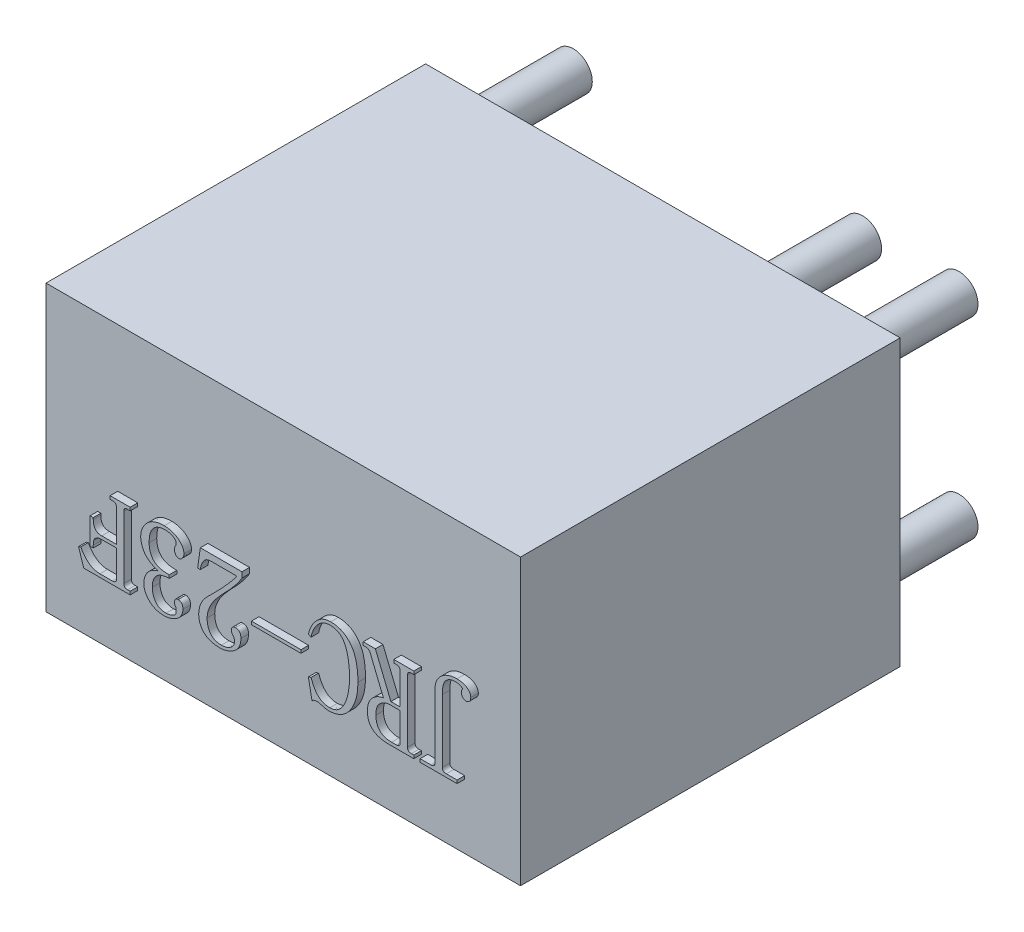
from build123d import *

# Parameters (mm, degrees)
SKETCH_1_W       = 12.5
SKETCH_1_H       = 7.5
EXTRUDE_1_DEPTH  = 10
SKETCH_2_R       = 0.5
EXTRUDE_2_DEPTH  = 3
WRAP_1_OUTLINE_W = 1.305555556
WRAP_1_OUTLINE_H = 0.083333333
WRAP_1_DEPTH     = 0.2


# Read off the part's stored shape, not the designer's step: 包覆1
with BuildPart() as part:
    # 草图1 → 凸台-拉伸1 (new body)
    with BuildSketch(Plane.XY):
        Rectangle(SKETCH_1_W, SKETCH_1_H)
    extrude(amount=EXTRUDE_1_DEPTH)

    # 草图2 → 凸台-拉伸2 (add)
    with BuildSketch(Plane(origin=(0, 0, 0), x_dir=(-1, 0, 0), z_dir=(0, 0, -1))):
        with Locations((-4.8, -2.54)):
            Circle(SKETCH_2_R)
        with Locations((-2.26, -2.54)):
            Circle(SKETCH_2_R)
        with Locations((5.36, -2.54)):
            Circle(SKETCH_2_R)
        with Locations(Location((-4.8, 2.54, 0), (0, 0, 180))):
            Circle(SKETCH_2_R)
        with Locations(Location((5.36, 2.54, 0), (0, 0, 180))):
            Circle(SKETCH_2_R)
        with Locations(Location((-2.26, 2.54, 0), (0, 0, 180))):
            Circle(SKETCH_2_R)
    extrude(amount=EXTRUDE_2_DEPTH)

    # 包覆1 outline → 包覆1 (add)
    # profile 1 of 7: a face of its own
    with BuildSketch(Plane.XY.offset(10)):
        with BuildLine():
            add(Edge.make_bspline(
                [(4.088541667, -1.972222222), (4.096110113, -1.972112893), (4.110551061, -1.971904287), (4.130804191, -1.966451246), (4.149495991, -1.960121566), (4.165109289, -1.949217072), (4.178890159, -1.936299355), (4.187652429, -1.919258866), (4.193825352, -1.899876347), (4.194229342, -1.885909039), (4.194444444, -1.878472222)],
                knots=[0, 0, 0, 0, 0.140958548, 0.268955466, 0.390585886, 0.507675788, 0.622491883, 0.739987644, 0.861557835, 1, 1, 1, 1], degree=3))
            Line((4.088541667, -1.972222222), (3.805555556, -1.972222222))
            Line((3.805555556, -1.972222222), (3.805555556, -2.055555556))
            Line((3.805555556, -2.055555556), (4.777777778, -2.055555556))
            Line((4.777777778, -2.055555556), (4.777777778, -1.972222222))
            Line((4.777777778, -1.972222222), (4.494791667, -1.972222222))
            add(Edge.make_bspline(
                [(4.388888889, -1.878472222), (4.388973594, -1.8859022), (4.38913189, -1.89978724), (4.394598992, -1.918896019), (4.400854026, -1.93587803), (4.412086053, -1.949552643), (4.426748668, -1.960335929), (4.446072554, -1.966900604), (4.468925899, -1.971904977), (4.485785593, -1.972111762), (4.494791667, -1.972222222)],
                knots=[0, 0, 0, 0, 0.135485952, 0.253194263, 0.362539149, 0.464425778, 0.5726392, 0.691831912, 0.835383441, 1, 1, 1, 1], degree=3))
            Line((4.388888889, -1.878472222), (4.388888889, -0.217881944))
            add(Edge.make_bspline(
                [(4.733940972, 0.25), (4.721343538, 0.24960677), (4.696797318, 0.248840557), (4.660710114, 0.244587293), (4.626541788, 0.236794903), (4.594157399, 0.22580886), (4.56349552, 0.212128236), (4.535292734, 0.194215889), (4.508061934, 0.17450857), (4.483146817, 0.150840614), (4.460443371, 0.122938134), (4.440944109, 0.089767258), (4.425172693, 0.05102853), (4.411685293, 0.007490039), (4.401423747, -0.041341391), (4.394345921, -0.095467493), (4.389304291, -0.154853823), (4.389031041, -0.196313482), (4.388888889, -0.217881944)],
                knots=[0, 0, 0, 0, 0.056791046, 0.110657896, 0.163492619, 0.214426009, 0.264615131, 0.314383114, 0.364724504, 0.415924345, 0.468779184, 0.52637318, 0.588622234, 0.656891803, 0.731582926, 0.813197416, 0.902820122, 1, 1, 1, 1], degree=3))
            add(Edge.make_bspline(
                [(4.924045139, 0.176649306), (4.919946215, 0.182646477), (4.911667194, 0.194759588), (4.894572882, 0.209279608), (4.875183778, 0.222233736), (4.852588681, 0.232514487), (4.82696126, 0.240072383), (4.798754461, 0.246505841), (4.767259116, 0.249031021), (4.745370749, 0.249667592), (4.733940972, 0.25)],
                knots=[0, 0, 0, 0, 0.10212947, 0.206281503, 0.313920344, 0.430902062, 0.554946282, 0.690759279, 0.838519129, 1, 1, 1, 1], degree=3))
            add(Edge.make_bspline(
                [(4.888888889, 0.091145833), (4.889086, 0.098827062), (4.889454279, 0.113178504), (4.893794243, 0.134823667), (4.905537796, 0.156316825), (4.917323057, 0.169264312), (4.924045139, 0.176649306)],
                knots=[0, 0, 0, 0, 0.241348464, 0.450930237, 0.686821346, 1, 1, 1, 1], degree=3))
            add(Edge.make_bspline(
                [(5.013888889, -0.055555556), (5.004842649, -0.0551368), (4.987208252, -0.054320493), (4.962511774, -0.045572326), (4.940349355, -0.032252077), (4.921933329, -0.013406735), (4.907143353, 0.009226274), (4.896950146, 0.034666745), (4.889959347, 0.062130269), (4.889253543, 0.081261612), (4.888888889, 0.091145833)],
                knots=[0, 0, 0, 0, 0.125442031, 0.244531959, 0.360236386, 0.482701014, 0.607819324, 0.734227546, 0.862688476, 1, 1, 1, 1], degree=3))
            add(Edge.make_bspline(
                [(5.138888889, 0.090277778), (5.13842087, 0.078803022), (5.137538794, 0.057176519), (5.130159463, 0.026851436), (5.117590986, 0.000989043), (5.099743342, -0.019371703), (5.07995275, -0.035445333), (5.058721931, -0.046901386), (5.036671126, -0.054426923), (5.021470497, -0.055179963), (5.013888889, -0.055555556)],
                knots=[0, 0, 0, 0, 0.160300387, 0.302118561, 0.433320879, 0.55819257, 0.677635349, 0.788085582, 0.894303581, 1, 1, 1, 1], degree=3))
            add(Edge.make_bspline(
                [(4.773003472, 0.333333333), (4.787326607, 0.332996096), (4.815136678, 0.332341311), (4.855686225, 0.329790221), (4.893398279, 0.323248709), (4.928847993, 0.315939136), (4.961407857, 0.305040651), (4.992116512, 0.293524587), (5.019375669, 0.277891174), (5.05172764, 0.255975961), (5.085643853, 0.225015335), (5.116617626, 0.183643765), (5.135293732, 0.137888131), (5.137685895, 0.106208926), (5.138888889, 0.090277778)],
                knots=[0, 0, 0, 0, 0.088162938, 0.171178832, 0.249616068, 0.323475084, 0.393569338, 0.460678001, 0.524828866, 0.586305594, 0.700969595, 0.805482684, 0.902179229, 1, 1, 1, 1], degree=3))
            add(Edge.make_bspline(
                [(4.194444444, -0.216579861), (4.194930165, -0.195723339), (4.195881562, -0.15487097), (4.203726056, -0.095384785), (4.216885414, -0.039495085), (4.234399195, 0.013162756), (4.25836255, 0.061901176), (4.286282522, 0.107974029), (4.320655977, 0.149658052), (4.359272257, 0.187816161), (4.401619371, 0.221959081), (4.447077908, 0.251581746), (4.495122743, 0.276986659), (4.545742315, 0.297636127), (4.598862137, 0.314031692), (4.654590738, 0.324976427), (4.712913691, 0.332279773), (4.752725666, 0.3329778), (4.773003472, 0.333333333)],
                knots=[0, 0, 0, 0, 0.069612051, 0.13635146, 0.199850536, 0.26109993, 0.321155047, 0.380800892, 0.440544437, 0.500996409, 0.561794703, 0.621810962, 0.681873847, 0.742955424, 0.804069456, 0.867155717, 0.932337178, 1, 1, 1, 1], degree=3))
            Line((4.194444444, -0.216579861), (4.194444444, -1.878472222))
        make_face()
    # profile 2 of 7: a face of its own
    with BuildSketch(Plane.XY.offset(10)):
        with BuildLine():
            add(Edge.make_bspline(
                [(2.490885417, -0.219184028), (2.487165761, -0.211982946), (2.480161265, -0.198422563), (2.467370087, -0.180822312), (2.453919873, -0.16657186), (2.434877746, -0.152904432), (2.408602473, -0.141275743), (2.386272878, -0.139689625), (2.375, -0.138888889)],
                knots=[0, 0, 0, 0, 0.162391778, 0.305800563, 0.435122477, 0.553562638, 0.774620449, 1, 1, 1, 1], degree=3))
            Line((2.490885417, -0.219184028), (2.838107639, -1.069444444))
            add(Edge.make_bspline(
                [(2.416666667, -1.5859375), (2.417096819, -1.566968632), (2.417936427, -1.529943569), (2.424064431, -1.476079891), (2.434035197, -1.425406088), (2.447707637, -1.377876596), (2.46605519, -1.333834687), (2.488377777, -1.293135992), (2.514396678, -1.255583568), (2.5446159, -1.221721065), (2.577410076, -1.191408487), (2.611259092, -1.163868754), (2.646282938, -1.139860757), (2.682279227, -1.11882214), (2.719762172, -1.101619149), (2.758094361, -1.087060724), (2.7976195, -1.076095104), (2.824603527, -1.071662656), (2.838107639, -1.069444444)],
                knots=[0, 0, 0, 0, 0.077701382, 0.151664214, 0.221756879, 0.289088697, 0.353921931, 0.416788188, 0.478940702, 0.540664994, 0.602309553, 0.661737288, 0.719278899, 0.776107893, 0.832324685, 0.888029848, 0.943964724, 1, 1, 1, 1], degree=3))
            add(Edge.make_bspline(
                [(2.975260417, -2.055555556), (2.953543566, -2.0552894), (2.91133358, -2.054772087), (2.850034847, -2.048852125), (2.792488305, -2.040143891), (2.738965897, -2.02673139), (2.688659579, -2.011218709), (2.642592513, -1.990537474), (2.600214093, -1.966683523), (2.561638435, -1.939210723), (2.527275008, -1.907993741), (2.497341697, -1.872953902), (2.472468763, -1.833842549), (2.452240544, -1.791189538), (2.435835525, -1.74516498), (2.42489774, -1.695291804), (2.417692442, -1.641848791), (2.417014841, -1.604915229), (2.416666667, -1.5859375)],
                knots=[0, 0, 0, 0, 0.078231985, 0.152055705, 0.221740855, 0.287748152, 0.350731523, 0.411184701, 0.469320569, 0.52574573, 0.58147288, 0.636213327, 0.691315067, 0.747980581, 0.806022863, 0.866984239, 0.931651949, 1, 1, 1, 1], degree=3))
            Line((2.975260417, -2.055555556), (3.638888889, -2.055555556))
            Line((3.638888889, -2.055555556), (3.638888889, -1.972222222))
            Line((3.638888889, -1.972222222), (3.572048611, -1.972222222))
            add(Edge.make_bspline(
                [(3.472222222, -1.879774306), (3.472387366, -1.887036916), (3.472698061, -1.900700534), (3.47721817, -1.919772096), (3.484033833, -1.936083896), (3.493799972, -1.949879127), (3.507739535, -1.96027242), (3.525595337, -1.967555045), (3.547555831, -1.971704983), (3.563494051, -1.972041567), (3.572048611, -1.972222222)],
                knots=[0, 0, 0, 0, 0.137957594, 0.25954853, 0.370573832, 0.47303595, 0.577150492, 0.696855208, 0.837292342, 1, 1, 1, 1], degree=3))
            Line((3.472222222, -1.879774306), (3.472222222, -0.231336806))
            add(Edge.make_bspline(
                [(3.572048611, -0.138888889), (3.563494207, -0.139069608), (3.547556278, -0.139406311), (3.525593923, -0.143555487), (3.507743752, -0.150840417), (3.493786515, -0.161226474), (3.484162217, -0.174938457), (3.477036378, -0.191128588), (3.47276955, -0.210288732), (3.472410902, -0.224080904), (3.472222222, -0.231336806)],
                knots=[0, 0, 0, 0, 0.162681349, 0.303095774, 0.422781134, 0.526878841, 0.629324391, 0.737809695, 0.862064713, 1, 1, 1, 1], degree=3))
            Line((3.572048611, -0.138888889), (3.638888889, -0.138888889))
            Line((3.638888889, -0.138888889), (3.638888889, -0.055555556))
            Line((3.638888889, -0.055555556), (3.111111111, -0.055555556))
            Line((3.111111111, -0.055555556), (3.111111111, -0.138888889))
            Line((3.111111111, -0.138888889), (3.177951389, -0.138888889))
            add(Edge.make_bspline(
                [(3.277777778, -0.23046875), (3.277477119, -0.223346381), (3.276903442, -0.209756462), (3.271707861, -0.190722897), (3.262775046, -0.174491773), (3.250438176, -0.161350435), (3.235295725, -0.151348236), (3.218160413, -0.143837223), (3.198711517, -0.139457509), (3.185063123, -0.139083679), (3.177951389, -0.138888889)],
                knots=[0, 0, 0, 0, 0.138944546, 0.265114757, 0.381504874, 0.497482502, 0.613494561, 0.733732761, 0.861256802, 1, 1, 1, 1], degree=3))
            Line((3.277777778, -0.23046875), (3.277777778, -1.055555556))
            Line((3.277777778, -1.055555556), (3.03515625, -1.055555556))
            Line((3.03515625, -1.055555556), (2.626302083, -0.055555556))
            Line((2.626302083, -0.055555556), (2.305555556, -0.055555556))
            Line((2.305555556, -0.055555556), (2.305555556, -0.138888889))
            Line((2.305555556, -0.138888889), (2.375, -0.138888889))
        make_face()
        with BuildLine():
            add(Edge.make_bspline(
                [(3.03125, -1.138888889), (3.017490666, -1.13923764), (2.99046715, -1.139922592), (2.950845723, -1.144860376), (2.912988051, -1.152432415), (2.876932652, -1.163885318), (2.84284177, -1.17881705), (2.809929824, -1.195918183), (2.779363984, -1.217268616), (2.750378131, -1.241153366), (2.724136648, -1.26881048), (2.700779866, -1.299704158), (2.681799441, -1.33482083), (2.666278182, -1.373333001), (2.653486266, -1.415084676), (2.645079701, -1.460659421), (2.639796798, -1.509712044), (2.639197846, -1.543677507), (2.638888889, -1.561197917)],
                knots=[0, 0, 0, 0, 0.063066198, 0.123862862, 0.182789201, 0.239845589, 0.29689041, 0.353268108, 0.409563813, 0.467481117, 0.525185349, 0.583950958, 0.644508365, 0.707571074, 0.77408654, 0.844330246, 0.919700848, 1, 1, 1, 1], degree=3))
            Line((3.03125, -1.138888889), (3.277777778, -1.138888889))
            Line((3.277777778, -1.138888889), (3.277777778, -1.881076389))
            add(Edge.make_bspline(
                [(3.177083333, -1.972222222), (3.184203126, -1.972047215), (3.197866984, -1.971711352), (3.217285067, -1.967051219), (3.234861313, -1.960412604), (3.250017173, -1.950166651), (3.262273786, -1.936943428), (3.2718113, -1.920959453), (3.276868214, -1.901769279), (3.277465004, -1.888192088), (3.277777778, -1.881076389)],
                knots=[0, 0, 0, 0, 0.138339697, 0.265492866, 0.386895269, 0.502569935, 0.61821027, 0.735656265, 0.86145954, 1, 1, 1, 1], degree=3))
            Line((3.177083333, -1.972222222), (3.053819444, -1.972222222))
            add(Edge.make_bspline(
                [(2.638888889, -1.561197917), (2.63922911, -1.576980877), (2.639889335, -1.607608856), (2.644807308, -1.652292368), (2.652460975, -1.694262324), (2.663217458, -1.733742317), (2.677693832, -1.770296677), (2.694908752, -1.804321795), (2.715706694, -1.835421613), (2.739042949, -1.864246017), (2.765976626, -1.890258809), (2.797291268, -1.911671922), (2.831377227, -1.930829654), (2.869352049, -1.945556648), (2.910438672, -1.958177225), (2.955222001, -1.965814064), (3.003332318, -1.971386696), (3.036584396, -1.971936994), (3.053819444, -1.972222222)],
                knots=[0, 0, 0, 0, 0.070832955, 0.137456492, 0.201524319, 0.262183892, 0.320792604, 0.377718557, 0.433013528, 0.488392332, 0.543972575, 0.600366342, 0.658207284, 0.719106242, 0.78280107, 0.850818457, 0.922676981, 1, 1, 1, 1], degree=3))
        make_face(mode=Mode.SUBTRACT)
    # profile 3 of 7: a face of its own
    with BuildSketch(Plane.XY.offset(10)):
        with BuildLine():
            add(Edge.make_bspline(
                [(2.166666667, -1.049479167), (2.166197382, -1.085964313), (2.165279285, -1.157342956), (2.154740166, -1.261983369), (2.139027282, -1.361957037), (2.116595557, -1.457404636), (2.086958839, -1.547733923), (2.051271798, -1.633451748), (2.009076087, -1.714363029), (1.960982653, -1.790076935), (1.906814648, -1.85850693), (1.848294513, -1.919117761), (1.784355397, -1.969743), (1.716011053, -2.011669105), (1.642622871, -2.043745336), (1.564691194, -2.066996749), (1.482093617, -2.080483106), (1.42554064, -2.082370735), (1.396701389, -2.083333333)],
                knots=[0, 0, 0, 0, 0.075844892, 0.148381082, 0.218467558, 0.286186838, 0.352024085, 0.415944427, 0.479056046, 0.541565299, 0.602177839, 0.660258585, 0.716359914, 0.771311197, 0.826540971, 0.882416776, 0.94003831, 1, 1, 1, 1], degree=3))
            add(Edge.make_bspline(
                [(1.44921875, -0.027777778), (1.476031071, -0.028480427), (1.528476181, -0.029854813), (1.604843027, -0.04200029), (1.677136664, -0.060952467), (1.745250939, -0.087968388), (1.809092449, -0.122958993), (1.868574068, -0.165820353), (1.923343471, -0.216771461), (1.974576495, -0.274618975), (2.020488394, -0.341170307), (2.05983079, -0.416607154), (2.092710911, -0.500845177), (2.119996679, -0.593626646), (2.140919533, -0.69527567), (2.155928489, -0.805619825), (2.165068241, -0.92461382), (2.166121954, -1.006927505), (2.166666667, -1.049479167)],
                knots=[0, 0, 0, 0, 0.056891628, 0.111280468, 0.163732767, 0.215295249, 0.266431466, 0.317920706, 0.37052657, 0.424936222, 0.481680896, 0.541722438, 0.605149109, 0.673375766, 0.746809909, 0.825261242, 0.909669645, 1, 1, 1, 1], degree=3))
            add(Edge.make_bspline(
                [(0.861111111, -0.602864583), (0.866163456, -0.582235139), (0.876115317, -0.54160027), (0.896039642, -0.482885565), (0.918408181, -0.426836308), (0.944190166, -0.373671603), (0.972745877, -0.323260179), (1.00460376, -0.275630359), (1.039743175, -0.230958731), (1.077788035, -0.189500546), (1.117979714, -0.151554994), (1.160456515, -0.118614826), (1.204637418, -0.090564007), (1.250230686, -0.067464522), (1.29760702, -0.049361167), (1.346698806, -0.036912944), (1.397478293, -0.02933131), (1.431831519, -0.028299838), (1.44921875, -0.027777778)],
                knots=[0, 0, 0, 0, 0.071661977, 0.141156253, 0.209079882, 0.275260678, 0.340437452, 0.404503355, 0.468494763, 0.532093639, 0.594285731, 0.65484975, 0.713242506, 0.770681973, 0.827097131, 0.884069671, 0.941324074, 1, 1, 1, 1], degree=3))
            Line((0.861111111, -0.602864583), (0.931857639, -0.638888889))
            add(Edge.make_bspline(
                [(1.437934028, -0.111111111), (1.422423737, -0.111465481), (1.391963449, -0.112161421), (1.347197475, -0.119543045), (1.304123872, -0.130714519), (1.262458101, -0.146482363), (1.222590734, -0.166880725), (1.184394285, -0.191996703), (1.147992403, -0.221600361), (1.113317322, -0.255485555), (1.081050649, -0.29303418), (1.051342008, -0.333697889), (1.024428761, -0.377261988), (1.000013717, -0.423736369), (0.978828508, -0.473468499), (0.960312199, -0.525987042), (0.94392286, -0.581245162), (0.935929164, -0.619436458), (0.931857639, -0.638888889)],
                knots=[0, 0, 0, 0, 0.058468665, 0.11482521, 0.170695924, 0.226149128, 0.282540026, 0.339312686, 0.398303879, 0.459291632, 0.521989676, 0.584875145, 0.649099026, 0.715019296, 0.782749722, 0.852842953, 0.925046738, 1, 1, 1, 1], degree=3))
            add(Edge.make_bspline(
                [(1.944444444, -1.049479167), (1.944173748, -1.01387987), (1.943646295, -0.944514564), (1.937758602, -0.843465899), (1.929007459, -0.748271471), (1.915903467, -0.659213413), (1.899655622, -0.575955345), (1.879268078, -0.498711858), (1.855520607, -0.42709473), (1.827949253, -0.361641881), (1.796690211, -0.302376198), (1.759668337, -0.25127587), (1.717874495, -0.208006529), (1.67142136, -0.17220132), (1.619680114, -0.144800936), (1.563233618, -0.125066851), (1.502085118, -0.11321406), (1.45968882, -0.111824259), (1.437934028, -0.111111111)],
                knots=[0, 0, 0, 0, 0.08937913, 0.174155429, 0.254079071, 0.329345058, 0.400091793, 0.466972155, 0.529811502, 0.589390821, 0.64514481, 0.697681434, 0.747265071, 0.79572882, 0.844323105, 0.893613092, 0.945409736, 1, 1, 1, 1], degree=3))
            add(Edge.make_bspline(
                [(1.426215278, -2), (1.446243807, -1.999150308), (1.485694298, -1.997476656), (1.543084688, -1.984693682), (1.596925697, -1.962988155), (1.64730223, -1.932822128), (1.69355509, -1.893436032), (1.736435973, -1.84601983), (1.775364521, -1.789965066), (1.810616486, -1.726264318), (1.84174026, -1.656193249), (1.869743285, -1.581670972), (1.892394431, -1.502742149), (1.911740627, -1.420080068), (1.926133758, -1.333198162), (1.937251415, -1.242288647), (1.943089722, -1.147212807), (1.943987116, -1.082472146), (1.944444444, -1.049479167)],
                knots=[0, 0, 0, 0, 0.050261158, 0.099000147, 0.146758664, 0.19547599, 0.24575421, 0.298730247, 0.355570674, 0.416715881, 0.481262585, 0.547928245, 0.616438893, 0.687284604, 0.760978705, 0.837441015, 0.917157081, 1, 1, 1, 1], degree=3))
            add(Edge.make_bspline(
                [(0.931857639, -1.555555556), (0.937746544, -1.573129803), (0.949287517, -1.607571508), (0.969362875, -1.656880566), (0.990549347, -1.703216216), (1.013649277, -1.746148136), (1.037799507, -1.78612168), (1.063523655, -1.822882538), (1.090802511, -1.856247006), (1.119508734, -1.88647599), (1.150233128, -1.913326442), (1.183050203, -1.936647921), (1.218122231, -1.956618747), (1.255667677, -1.971858933), (1.295027698, -1.98477964), (1.336749141, -1.993821364), (1.380797555, -1.999032422), (1.410865486, -1.999672989), (1.426215278, -2)],
                knots=[0, 0, 0, 0, 0.077291875, 0.151475268, 0.22194541, 0.28971007, 0.354704288, 0.416648996, 0.47668606, 0.534305854, 0.590336361, 0.646597119, 0.701987031, 0.75824779, 0.81530871, 0.874610369, 0.93598812, 1, 1, 1, 1], degree=3))
            Line((0.931857639, -1.555555556), (0.861111111, -1.578559028))
            Line((0.861111111, -1.578559028), (0.958333333, -2.083333333))
            add(Edge.make_bspline(
                [(1.088541667, -2.024739583), (1.074177712, -2.025255583), (1.048159693, -2.026190235), (1.011671124, -2.034486697), (0.980438292, -2.053395644), (0.966078743, -2.072843394), (0.958333333, -2.083333333)],
                knots=[0, 0, 0, 0, 0.287283444, 0.520368262, 0.741291015, 1, 1, 1, 1], degree=3))
            add(Edge.make_bspline(
                [(1.396701389, -2.083333333), (1.38293739, -2.083027836), (1.355149985, -2.082411084), (1.313643328, -2.076448047), (1.271992907, -2.067320888), (1.231300455, -2.054674732), (1.192447809, -2.040940375), (1.155221104, -2.032016423), (1.121014529, -2.025783199), (1.098982206, -2.025075122), (1.088541667, -2.024739583)],
                knots=[0, 0, 0, 0, 0.130963566, 0.264395382, 0.398401772, 0.536528105, 0.669810553, 0.79040482, 0.900678349, 1, 1, 1, 1], degree=3))
        make_face()
    # profile 4 of 7: a face of its own
    with BuildSketch(Plane.XY.offset(10)):
        with BuildLine():
            add(Edge.make_bspline(
                [(-1.427083333, -2), (-1.40414308, -1.99913185), (-1.359695541, -1.997449778), (-1.295724497, -1.983007049), (-1.236744481, -1.960248428), (-1.192900024, -1.932654176), (-1.161291576, -1.907400133), (-1.141084332, -1.886443924), (-1.123292098, -1.864808729), (-1.109466491, -1.841350229), (-1.097996022, -1.817214971), (-1.089989621, -1.791521792), (-1.08585663, -1.76460227), (-1.085045308, -1.746250659), (-1.084635417, -1.736979167)],
                knots=[0, 0, 0, 0, 0.143267064, 0.277584921, 0.407933192, 0.536705751, 0.599714332, 0.660481917, 0.718402274, 0.774404942, 0.830253987, 0.88518717, 0.941994943, 1, 1, 1, 1], degree=3))
            add(Edge.make_bspline(
                [(-1.805555556, -1.566840278), (-1.805415038, -1.583928034), (-1.805142919, -1.617019332), (-1.799920823, -1.665103024), (-1.792989563, -1.710169048), (-1.782322489, -1.75202545), (-1.76963443, -1.791063336), (-1.752879167, -1.826639328), (-1.733840969, -1.859534123), (-1.711667926, -1.889212926), (-1.686320347, -1.915502171), (-1.657914829, -1.938082789), (-1.626713885, -1.957568668), (-1.5923186, -1.972974748), (-1.555093588, -1.985253773), (-1.515070529, -1.993752634), (-1.472078237, -1.999113254), (-1.442435915, -1.999697436), (-1.427083333, -2)],
                knots=[0, 0, 0, 0, 0.077930574, 0.150916467, 0.220490125, 0.285821419, 0.347828954, 0.407497221, 0.464905586, 0.521023883, 0.576119231, 0.631075956, 0.686222705, 0.743539885, 0.80262454, 0.864783026, 0.929967373, 1, 1, 1, 1], degree=3))
            add(Edge.make_bspline(
                [(-1.440538194, -0.864149306), (-1.470154157, -0.896504564), (-1.527098977, -0.958716432), (-1.602958671, -1.053894668), (-1.666339819, -1.146310097), (-1.717172184, -1.236076054), (-1.75619145, -1.322884395), (-1.784428615, -1.406497601), (-1.801965691, -1.487552765), (-1.804379447, -1.540864178), (-1.805555556, -1.566840278)],
                knots=[0, 0, 0, 0, 0.162474748, 0.312402308, 0.450516974, 0.577238445, 0.694086835, 0.802568253, 0.903800959, 1, 1, 1, 1], degree=3))
            add(Edge.make_bspline(
                [(-0.888888889, -0.200086806), (-0.899902826, -0.21935435), (-0.923788025, -0.261138601), (-0.968659437, -0.32491937), (-1.021368897, -0.39725182), (-1.07259622, -0.461290258), (-1.118154202, -0.516483803), (-1.155939432, -0.560870971), (-1.196761533, -0.606740482), (-1.240319508, -0.65448938), (-1.286183692, -0.704529732), (-1.3352742, -0.756007803), (-1.387022723, -0.809443525), (-1.422437761, -0.845646276), (-1.440538194, -0.864149306)],
                knots=[0, 0, 0, 0, 0.076888688, 0.166743419, 0.270053403, 0.387140391, 0.450899533, 0.518129809, 0.589177495, 0.663728026, 0.742159742, 0.824454616, 0.910279711, 1, 1, 1, 1], degree=3))
            Line((-0.888888889, -0.200086806), (-0.888888889, -0.055555556))
            Line((-0.888888889, -0.055555556), (-1.984809028, -0.055555556))
            Line((-1.984809028, -0.055555556), (-2.055555556, -0.555555556))
            Line((-2.055555556, -0.555555556), (-1.985677083, -0.555555556))
            add(Edge.make_bspline(
                [(-1.717013889, -0.222222222), (-1.733927873, -0.223161785), (-1.767078142, -0.225003266), (-1.814380333, -0.24148279), (-1.856982433, -0.268272246), (-1.894737006, -0.305615564), (-1.927065518, -0.353355655), (-1.952724194, -0.41169216), (-1.973130715, -0.479950523), (-1.981334906, -0.529389382), (-1.985677083, -0.555555556)],
                knots=[0, 0, 0, 0, 0.107580609, 0.210850743, 0.315284474, 0.426183702, 0.54695673, 0.680715486, 0.831014423, 1, 1, 1, 1], degree=3))
            Line((-1.717013889, -0.222222222), (-1.027777778, -0.222222222))
            add(Edge.make_bspline(
                [(-1.7578125, -1.039930556), (-1.730580476, -1.012909131), (-1.677568793, -0.960307413), (-1.600919646, -0.883163921), (-1.528983058, -0.81012677), (-1.462272004, -0.740696539), (-1.400163169, -0.675194687), (-1.343000801, -0.613716096), (-1.290617487, -0.556266722), (-1.243339749, -0.502549093), (-1.201070378, -0.452570547), (-1.162589458, -0.407383573), (-1.128661442, -0.366312458), (-1.099780114, -0.329105492), (-1.075278553, -0.296430629), (-1.055186542, -0.268154827), (-1.039287037, -0.24418305), (-1.031295724, -0.228934818), (-1.027777778, -0.222222222)],
                knots=[0, 0, 0, 0, 0.104788244, 0.203987822, 0.297043227, 0.384801622, 0.466985722, 0.543601701, 0.614098943, 0.679341921, 0.7390507, 0.792888057, 0.841463035, 0.884544884, 0.921533799, 0.953002124, 0.979310535, 1, 1, 1, 1], degree=3))
            add(Edge.make_bspline(
                [(-2.027777778, -1.591145833), (-2.027046901, -1.567656399), (-2.025571013, -1.520223289), (-2.012757221, -1.449371608), (-1.992700109, -1.378526059), (-1.964456633, -1.307896344), (-1.926769547, -1.238257008), (-1.879924532, -1.169671985), (-1.823363292, -1.102744469), (-1.780056638, -1.061245955), (-1.7578125, -1.039930556)],
                knots=[0, 0, 0, 0, 0.111388457, 0.224930963, 0.340544613, 0.460380004, 0.585085801, 0.715521829, 0.853879924, 1, 1, 1, 1], degree=3))
            add(Edge.make_bspline(
                [(-1.472222222, -2.083333333), (-1.495093848, -2.082925322), (-1.539488507, -2.082133358), (-1.603847863, -2.075796953), (-1.663416877, -2.064326438), (-1.718604153, -2.049589824), (-1.768706373, -2.029221826), (-1.81484159, -2.005662245), (-1.855889204, -1.976583839), (-1.892514267, -1.943669516), (-1.923808187, -1.906859688), (-1.9521373, -1.868624532), (-1.975533281, -1.82761609), (-1.994634747, -1.78454929), (-2.009656382, -1.739370484), (-2.01976723, -1.691900478), (-2.02662571, -1.642270173), (-2.027389273, -1.608386184), (-2.027777778, -1.591145833)],
                knots=[0, 0, 0, 0, 0.081543393, 0.1582787, 0.230210067, 0.297666768, 0.361557987, 0.422701798, 0.481949248, 0.540382696, 0.597789365, 0.653918738, 0.709839133, 0.765723829, 0.821675145, 0.879248439, 0.938560975, 1, 1, 1, 1], degree=3))
            add(Edge.make_bspline(
                [(-0.916666667, -1.588975694), (-0.917046704, -1.608546116), (-0.917785528, -1.646592699), (-0.926999745, -1.701832988), (-0.940640466, -1.753558235), (-0.959756133, -1.802032615), (-0.985140752, -1.846409124), (-1.016015229, -1.887276947), (-1.052081445, -1.924861238), (-1.093776312, -1.95771753), (-1.138148221, -1.986680659), (-1.183495825, -2.012715252), (-1.229894915, -2.034257698), (-1.276871773, -2.052172225), (-1.324589866, -2.066224489), (-1.373058987, -2.076244291), (-1.422466229, -2.081872625), (-1.455571154, -2.082844501), (-1.472222222, -2.083333333)],
                knots=[0, 0, 0, 0, 0.070597237, 0.137247101, 0.20162441, 0.263518204, 0.324818258, 0.385628824, 0.448069205, 0.512361668, 0.576840646, 0.639307249, 0.701008925, 0.761359959, 0.820707732, 0.880440557, 0.939864162, 1, 1, 1, 1], degree=3))
            add(Edge.make_bspline(
                [(-1.058159722, -1.416666667), (-1.047691092, -1.41713723), (-1.02776755, -1.418032791), (-0.999530015, -1.425639209), (-0.974661759, -1.438198146), (-0.953878255, -1.456778251), (-0.935959752, -1.48033907), (-0.925057933, -1.511304409), (-0.917325571, -1.54793395), (-0.91689748, -1.574598788), (-0.916666667, -1.588975694)],
                knots=[0, 0, 0, 0, 0.123149291, 0.234373542, 0.341865125, 0.448174475, 0.560335149, 0.686629183, 0.831039556, 1, 1, 1, 1], degree=3))
            add(Edge.make_bspline(
                [(-1.166666667, -1.53125), (-1.166384142, -1.522248588), (-1.165850069, -1.505232652), (-1.160598131, -1.481617881), (-1.152433513, -1.461361581), (-1.14040323, -1.444777103), (-1.12462828, -1.431716965), (-1.10533695, -1.422786606), (-1.082747507, -1.417455429), (-1.066728308, -1.416941542), (-1.058159722, -1.416666667)],
                knots=[0, 0, 0, 0, 0.149040261, 0.281740182, 0.398917937, 0.508796429, 0.617833734, 0.734790282, 0.858140715, 1, 1, 1, 1], degree=3))
            add(Edge.make_bspline(
                [(-1.084635417, -1.736979167), (-1.085079601, -1.725924285), (-1.08593926, -1.704529017), (-1.094170332, -1.674187342), (-1.106618207, -1.64621979), (-1.125567312, -1.623127809), (-1.143912215, -1.601150517), (-1.156404725, -1.577783689), (-1.165165986, -1.5547223), (-1.166171664, -1.538992391), (-1.166666667, -1.53125)],
                knots=[0, 0, 0, 0, 0.146108122, 0.282773037, 0.413952653, 0.548108497, 0.676529107, 0.792315623, 0.897776042, 1, 1, 1, 1], degree=3))
        make_face()
    # profile 5 of 7: a face of its own
    with BuildSketch(Plane.XY.offset(10)):
        with BuildLine():
            add(Edge.make_bspline(
                [(-2.933159722, -0.027777778), (-2.915781011, -0.028055692), (-2.881650929, -0.028601489), (-2.831470677, -0.034556526), (-2.783137513, -0.04355799), (-2.736568955, -0.056232708), (-2.691683776, -0.072091709), (-2.649020976, -0.092382859), (-2.607905093, -0.115767981), (-2.569443474, -0.143047738), (-2.533739943, -0.17188409), (-2.502607012, -0.202649817), (-2.475910024, -0.234084636), (-2.454486587, -0.267167193), (-2.437077689, -0.301016934), (-2.425700055, -0.336555212), (-2.417655578, -0.372758444), (-2.416996852, -0.397380484), (-2.416666667, -0.409722222)],
                knots=[0, 0, 0, 0, 0.073670561, 0.144681743, 0.213997339, 0.282019047, 0.349171789, 0.415597375, 0.482113583, 0.54952093, 0.615357295, 0.676534078, 0.734904909, 0.789874331, 0.843382637, 0.895771064, 0.947755498, 1, 1, 1, 1], degree=3))
            add(Edge.make_bspline(
                [(-3.555555556, -0.591145833), (-3.555089678, -0.572739257), (-3.554171925, -0.53647927), (-3.545833458, -0.483054648), (-3.533546749, -0.430995761), (-3.515079641, -0.380811954), (-3.492035177, -0.332148457), (-3.463386039, -0.285640843), (-3.430435006, -0.240129048), (-3.391957071, -0.197207965), (-3.349294295, -0.157059908), (-3.301773493, -0.122261985), (-3.250024891, -0.092943513), (-3.19433402, -0.069217621), (-3.134753769, -0.050398475), (-3.071245352, -0.037031432), (-3.003525714, -0.029185692), (-2.957052429, -0.028255834), (-2.933159722, -0.027777778)],
                knots=[0, 0, 0, 0, 0.058709639, 0.115654902, 0.172213174, 0.229180899, 0.285979942, 0.343791074, 0.403271069, 0.465087321, 0.527494046, 0.589928099, 0.652587152, 0.716918571, 0.782782919, 0.851703655, 0.923758322, 1, 1, 1, 1], degree=3))
            add(Edge.make_bspline(
                [(-3.103298611, -1.142795139), (-3.124365476, -1.134919111), (-3.165207505, -1.119649969), (-3.223090446, -1.093766295), (-3.275408505, -1.06529483), (-3.322862933, -1.035531969), (-3.365201436, -1.00382573), (-3.402305268, -0.970320781), (-3.434507943, -0.935071775), (-3.468869959, -0.885710433), (-3.503073475, -0.822591198), (-3.532995643, -0.745601171), (-3.551861775, -0.668437549), (-3.554333882, -0.616709132), (-3.555555556, -0.591145833)],
                knots=[0, 0, 0, 0, 0.088125829, 0.17084828, 0.248222076, 0.321360993, 0.390188975, 0.455213125, 0.517034219, 0.57681197, 0.690474043, 0.797446202, 0.899901378, 1, 1, 1, 1], degree=3))
            add(Edge.make_bspline(
                [(-3.472222222, -1.625), (-3.472021755, -1.610520039), (-3.471627886, -1.582070387), (-3.467057096, -1.540316579), (-3.460186703, -1.500284466), (-3.450671204, -1.461769214), (-3.438115315, -1.425061161), (-3.422800104, -1.389887997), (-3.40453299, -1.356553535), (-3.383629626, -1.324665625), (-3.359798351, -1.29445142), (-3.332125628, -1.266910813), (-3.302172192, -1.240474352), (-3.268506956, -1.216612584), (-3.23164214, -1.195092353), (-3.191728218, -1.175453947), (-3.148875708, -1.157567852), (-3.118710905, -1.147790661), (-3.103298611, -1.142795139)],
                knots=[0, 0, 0, 0, 0.065983825, 0.129642395, 0.191231003, 0.251056909, 0.310290935, 0.367882922, 0.425731143, 0.483353335, 0.541550167, 0.600780521, 0.661088011, 0.723497508, 0.788538469, 0.855494116, 0.926166691, 1, 1, 1, 1], degree=3))
            add(Edge.make_bspline(
                [(-2.952256944, -2.083333333), (-2.971520337, -2.08296801), (-3.009166822, -2.082254059), (-3.06411275, -2.075177938), (-3.115976788, -2.063471228), (-3.164943045, -2.047290896), (-3.211220384, -2.026993124), (-3.254472213, -2.001642927), (-3.294517439, -1.971494838), (-3.331104778, -1.937396517), (-3.363716234, -1.900531263), (-3.392912487, -1.86304809), (-3.417455014, -1.824742796), (-3.436970367, -1.785754897), (-3.452917645, -1.746528564), (-3.46425499, -1.706537853), (-3.470948866, -1.665881011), (-3.471797874, -1.638623674), (-3.472222222, -1.625)],
                knots=[0, 0, 0, 0, 0.075170665, 0.146906172, 0.215824927, 0.282444288, 0.347933606, 0.412737411, 0.47768872, 0.543229163, 0.607628063, 0.669647485, 0.728559586, 0.784886285, 0.839633442, 0.893629639, 0.946834312, 1, 1, 1, 1], degree=3))
            add(Edge.make_bspline(
                [(-2.444444444, -1.689670139), (-2.445008685, -1.703871228), (-2.446115231, -1.731721295), (-2.452939089, -1.772538228), (-2.465500249, -1.810988113), (-2.481915018, -1.847954942), (-2.503867904, -1.882708058), (-2.53054492, -1.915486163), (-2.56221704, -1.945946263), (-2.597838895, -1.974272824), (-2.636876983, -1.999530032), (-2.677428876, -2.022328797), (-2.719917674, -2.040765433), (-2.763363987, -2.056847004), (-2.808704363, -2.068191033), (-2.855191449, -2.077034658), (-2.903232725, -2.082367615), (-2.935750695, -2.08300818), (-2.952256944, -2.083333333)],
                knots=[0, 0, 0, 0, 0.059758024, 0.117192767, 0.17339859, 0.229512066, 0.286930682, 0.345770403, 0.406889106, 0.471430367, 0.536928775, 0.602311139, 0.666889696, 0.73157715, 0.796973677, 0.863225612, 0.930572785, 1, 1, 1, 1], degree=3))
            add(Edge.make_bspline(
                [(-2.566840278, -1.527777778), (-2.559413936, -1.528191307), (-2.544561253, -1.529018366), (-2.522866526, -1.535924549), (-2.502255312, -1.547083261), (-2.482307741, -1.562231458), (-2.464717518, -1.583784586), (-2.452193301, -1.61291824), (-2.445943408, -1.649188029), (-2.444970227, -1.675470478), (-2.444444444, -1.689670139)],
                knots=[0, 0, 0, 0, 0.097148675, 0.194297351, 0.295220187, 0.40329667, 0.520544616, 0.65547884, 0.813865002, 1, 1, 1, 1], degree=3))
            add(Edge.make_bspline(
                [(-2.666666667, -1.654513889), (-2.666473672, -1.645381114), (-2.666103597, -1.62786865), (-2.661783789, -1.603178471), (-2.654736536, -1.581413458), (-2.645409031, -1.562356491), (-2.632139758, -1.546341093), (-2.61384508, -1.535290028), (-2.591574078, -1.528810022), (-2.5754236, -1.528135996), (-2.566840278, -1.527777778)],
                knots=[0, 0, 0, 0, 0.148239396, 0.284255027, 0.405406033, 0.518930276, 0.627275735, 0.738141193, 0.8608327, 1, 1, 1, 1], degree=3))
            add(Edge.make_bspline(
                [(-2.619791667, -1.827256944), (-2.619921457, -1.813339273), (-2.620154834, -1.788313897), (-2.624435885, -1.755044746), (-2.630576304, -1.729422583), (-2.642172473, -1.712553881), (-2.654411076, -1.700819529), (-2.660805941, -1.686122044), (-2.666256649, -1.670966439), (-2.666528263, -1.660067538), (-2.666666667, -1.654513889)],
                knots=[0, 0, 0, 0, 0.227108919, 0.408364713, 0.549011533, 0.651318197, 0.738518995, 0.823116194, 0.909867003, 1, 1, 1, 1], degree=3))
            add(Edge.make_bspline(
                [(-2.888454861, -2), (-2.874537512, -1.999439645), (-2.846086191, -1.998294107), (-2.802840838, -1.990592543), (-2.758275713, -1.977745659), (-2.720940197, -1.963298535), (-2.691628793, -1.949599996), (-2.672520111, -1.936845308), (-2.655853504, -1.922954519), (-2.642981953, -1.906587868), (-2.632312429, -1.889212986), (-2.624754446, -1.870008494), (-2.620422233, -1.849155512), (-2.620004716, -1.834655796), (-2.619791667, -1.827256944)],
                knots=[0, 0, 0, 0, 0.117965655, 0.241157896, 0.371210036, 0.510595859, 0.580253691, 0.644882434, 0.704876614, 0.763295735, 0.820505112, 0.877212759, 0.937344669, 1, 1, 1, 1], degree=3))
            add(Edge.make_bspline(
                [(-3.25, -1.589409722), (-3.248897582, -1.615966103), (-3.246743846, -1.667847889), (-3.230368449, -1.743253596), (-3.202709112, -1.81338124), (-3.170942367, -1.867241321), (-3.140286514, -1.906188115), (-3.113217416, -1.931288627), (-3.083257748, -1.95249832), (-3.050231697, -1.970196065), (-3.014105405, -1.983498966), (-2.974918785, -1.992943974), (-2.932789212, -1.999322632), (-2.90352606, -1.999769733), (-2.888454861, -2)],
                knots=[0, 0, 0, 0, 0.12882703, 0.251682503, 0.37243084, 0.493340373, 0.553766585, 0.612391096, 0.671817575, 0.731504852, 0.79372022, 0.858097363, 0.926916865, 1, 1, 1, 1], degree=3))
            add(Edge.make_bspline(
                [(-2.805555556, -1.166666667), (-2.823943229, -1.166972701), (-2.859495117, -1.167564406), (-2.911000718, -1.172874989), (-2.95881209, -1.181341521), (-3.00297513, -1.193571293), (-3.043645539, -1.208939861), (-3.080178526, -1.228680618), (-3.113203235, -1.251394018), (-3.14241198, -1.277476121), (-3.167749198, -1.307025836), (-3.189925471, -1.339145845), (-3.208774907, -1.374198583), (-3.223865111, -1.412096166), (-3.235633762, -1.452656592), (-3.243634911, -1.495848765), (-3.249120275, -1.541671601), (-3.249701079, -1.573188825), (-3.25, -1.589409722)],
                knots=[0, 0, 0, 0, 0.07857961, 0.151930776, 0.221073399, 0.285890689, 0.347563428, 0.40649631, 0.462936345, 0.518557277, 0.573360821, 0.628940481, 0.685108808, 0.743102943, 0.802991791, 0.865333749, 0.930691634, 1, 1, 1, 1], degree=3))
            Line((-2.805555556, -1.166666667), (-2.805555556, -1.083333333))
            add(Edge.make_bspline(
                [(-3.333333333, -0.614583333), (-3.333023486, -0.631814243), (-3.332420513, -0.665346092), (-3.32704482, -0.714389008), (-3.318498412, -0.760861826), (-3.306352103, -0.804891166), (-3.290711375, -0.846326345), (-3.271568184, -0.885171759), (-3.248850372, -0.921358083), (-3.222721657, -0.955240879), (-3.191783427, -0.98624036), (-3.154121202, -1.012292166), (-3.110621633, -1.034539219), (-3.06115445, -1.052475019), (-3.005723132, -1.066329469), (-2.944435915, -1.076032805), (-2.877002876, -1.082129137), (-2.830019706, -1.082921007), (-2.805555556, -1.083333333)],
                knots=[0, 0, 0, 0, 0.063469431, 0.12351335, 0.181538101, 0.237407303, 0.291561651, 0.344484695, 0.39669421, 0.448729275, 0.501877342, 0.557338176, 0.616701512, 0.681462821, 0.750760037, 0.826914251, 0.9098742, 1, 1, 1, 1], degree=3))
            add(Edge.make_bspline(
                [(-2.904947917, -0.111111111), (-2.92218695, -0.111341267), (-2.955767993, -0.111789603), (-3.004364638, -0.118229679), (-3.049796304, -0.127455546), (-3.091835809, -0.141048282), (-3.130682062, -0.158302709), (-3.165988373, -0.179754511), (-3.198247738, -0.204742395), (-3.226922252, -0.233988924), (-3.252276471, -0.267239372), (-3.274030482, -0.304645761), (-3.292788576, -0.345851158), (-3.307415102, -0.391671063), (-3.318903758, -0.441487433), (-3.327783825, -0.495530708), (-3.332244684, -0.553743532), (-3.332963025, -0.593888449), (-3.333333333, -0.614583333)],
                knots=[0, 0, 0, 0, 0.068148208, 0.132750359, 0.19359208, 0.251331465, 0.307178941, 0.361362152, 0.414371845, 0.468200209, 0.522918858, 0.579361466, 0.63904533, 0.701670025, 0.769280132, 0.841168847, 0.918121827, 1, 1, 1, 1], degree=3))
            add(Edge.make_bspline(
                [(-2.619791667, -0.272569444), (-2.620899337, -0.26121548), (-2.6231368, -0.238280801), (-2.64149962, -0.206398085), (-2.670621075, -0.178728656), (-2.709439933, -0.155595993), (-2.754110155, -0.136369262), (-2.802118246, -0.121065459), (-2.852887505, -0.113076149), (-2.88741816, -0.111772778), (-2.904947917, -0.111111111)],
                knots=[0, 0, 0, 0, 0.094992551, 0.19188221, 0.301126318, 0.430070486, 0.569517766, 0.709573885, 0.852562914, 1, 1, 1, 1], degree=3))
            add(Edge.make_bspline(
                [(-2.666666667, -0.4453125), (-2.666538986, -0.436018654), (-2.666291702, -0.418018968), (-2.660920287, -0.392415433), (-2.654617858, -0.368361204), (-2.640229023, -0.341590872), (-2.623509761, -0.311089476), (-2.620956772, -0.28464012), (-2.619791667, -0.272569444)],
                knots=[0, 0, 0, 0, 0.153685407, 0.297647418, 0.432743465, 0.563621109, 0.800850055, 1, 1, 1, 1], degree=3))
            add(Edge.make_bspline(
                [(-2.547309028, -0.583333333), (-2.557553656, -0.582944235), (-2.57688443, -0.582210039), (-2.603215705, -0.5714381), (-2.625147525, -0.554974191), (-2.640348676, -0.53207341), (-2.651477399, -0.507997711), (-2.659595841, -0.485109578), (-2.665486649, -0.464553721), (-2.666292027, -0.451421322), (-2.666666667, -0.4453125)],
                knots=[0, 0, 0, 0, 0.150563061, 0.284100151, 0.413809169, 0.550398543, 0.68538559, 0.805886226, 0.909703751, 1, 1, 1, 1], degree=3))
            add(Edge.make_bspline(
                [(-2.416666667, -0.409722222), (-2.417117707, -0.420915766), (-2.418009269, -0.443041785), (-2.426583857, -0.474936912), (-2.44031918, -0.504778697), (-2.459006932, -0.531266964), (-2.480338746, -0.55336521), (-2.50195301, -0.570672075), (-2.524654239, -0.580858135), (-2.539993725, -0.582534084), (-2.547309028, -0.583333333)],
                knots=[0, 0, 0, 0, 0.141855222, 0.280401938, 0.415995277, 0.557135257, 0.689633082, 0.80498068, 0.906996538, 1, 1, 1, 1], degree=3))
        make_face()
    # profile 6 of 7: a face of its own
    with BuildSketch(Plane.XY.offset(10)):
        with BuildLine():
            add(Edge.make_bspline(
                [(-3.90625, -0.138888889), (-3.914222568, -0.139081516), (-3.929150221, -0.139442187), (-3.949745702, -0.143486548), (-3.966425381, -0.151077881), (-3.979783274, -0.161240084), (-3.988929166, -0.174986358), (-3.995626308, -0.191173719), (-3.99932975, -0.21034062), (-3.999768609, -0.224088263), (-4, -0.231336806)],
                knots=[0, 0, 0, 0, 0.156710886, 0.293421849, 0.409268542, 0.514574189, 0.618759325, 0.729716652, 0.857491192, 1, 1, 1, 1], degree=3))
            Line((-3.90625, -0.138888889), (-3.833333333, -0.138888889))
            Line((-3.833333333, -0.138888889), (-3.833333333, -0.055555556))
            Line((-3.833333333, -0.055555556), (-4.361111111, -0.055555556))
            Line((-4.361111111, -0.055555556), (-4.361111111, -0.138888889))
            Line((-4.361111111, -0.138888889), (-4.288194444, -0.138888889))
            add(Edge.make_bspline(
                [(-4.194444444, -0.232204861), (-4.19475966, -0.224796745), (-4.195348363, -0.210961174), (-4.200150821, -0.191547617), (-4.208425994, -0.175148186), (-4.220120869, -0.161864211), (-4.234132375, -0.151289655), (-4.250458173, -0.143949175), (-4.26870927, -0.139428821), (-4.281511111, -0.139074083), (-4.288194444, -0.138888889)],
                knots=[0, 0, 0, 0, 0.147914949, 0.276249418, 0.396512757, 0.511298596, 0.626955137, 0.744689291, 0.866712423, 1, 1, 1, 1], degree=3))
            Line((-4.194444444, -0.232204861), (-4.194444444, -1.083333333))
            Line((-4.194444444, -1.083333333), (-4.582465278, -1.083333333))
            add(Edge.make_bspline(
                [(-4.805555556, -0.821614583), (-4.804952246, -0.842061109), (-4.80381858, -0.880481691), (-4.793893521, -0.934223903), (-4.77770712, -0.980168196), (-4.754473384, -1.018515318), (-4.722878288, -1.048541897), (-4.682761667, -1.068837009), (-4.635197419, -1.081784882), (-4.600790272, -1.08279523), (-4.582465278, -1.083333333)],
                knots=[0, 0, 0, 0, 0.155141756, 0.291523196, 0.413157736, 0.523197267, 0.628884701, 0.739449379, 0.861232647, 1, 1, 1, 1], degree=3))
            Line((-4.805555556, -0.821614583), (-4.805555556, -0.777777778))
            Line((-4.805555556, -0.777777778), (-4.888888889, -0.777777778))
            Line((-4.888888889, -0.777777778), (-4.888888889, -1.472222222))
            Line((-4.888888889, -1.472222222), (-4.805555556, -1.472222222))
            Line((-4.805555556, -1.472222222), (-4.805555556, -1.408420139))
            add(Edge.make_bspline(
                [(-4.582465278, -1.166666667), (-4.600763955, -1.167175338), (-4.634988428, -1.168126719), (-4.682382945, -1.179106115), (-4.722314944, -1.196602285), (-4.754187491, -1.222880436), (-4.777829516, -1.257555998), (-4.794107699, -1.300468211), (-4.803795141, -1.351714124), (-4.80494329, -1.388697997), (-4.805555556, -1.408420139)],
                knots=[0, 0, 0, 0, 0.144058031, 0.269435328, 0.38124366, 0.484969861, 0.590691398, 0.708498621, 0.844553015, 1, 1, 1, 1], degree=3))
            Line((-4.582465278, -1.166666667), (-4.194444444, -1.166666667))
            Line((-4.194444444, -1.166666667), (-4.194444444, -1.8828125))
            add(Edge.make_bspline(
                [(-4.300347222, -1.972222222), (-4.292794831, -1.972053332), (-4.278416783, -1.971731803), (-4.257983997, -1.967075034), (-4.239681799, -1.960362069), (-4.223649595, -1.950643372), (-4.210194229, -1.938083261), (-4.201115095, -1.921816), (-4.195170407, -1.903186956), (-4.194693677, -1.889807319), (-4.194444444, -1.8828125)],
                knots=[0, 0, 0, 0, 0.143952777, 0.274053596, 0.398267679, 0.514869451, 0.63018677, 0.74537154, 0.866881277, 1, 1, 1, 1], degree=3))
            Line((-4.300347222, -1.972222222), (-4.629774306, -1.972222222))
            add(Edge.make_bspline(
                [(-5.135416667, -1.611111111), (-5.119712746, -1.639723842), (-5.089403303, -1.69494801), (-5.035050835, -1.768473327), (-4.977257684, -1.831655486), (-4.914314972, -1.882887497), (-4.84756865, -1.922733069), (-4.777698412, -1.951371009), (-4.7047243, -1.969065939), (-4.654900922, -1.971164094), (-4.629774306, -1.972222222)],
                knots=[0, 0, 0, 0, 0.149293333, 0.28814446, 0.417508379, 0.540413841, 0.658335974, 0.772122117, 0.885078039, 1, 1, 1, 1], degree=3))
            Line((-5.135416667, -1.611111111), (-5.194444444, -1.634548611))
            Line((-5.194444444, -1.634548611), (-5.053819444, -2.055555556))
            Line((-5.053819444, -2.055555556), (-3.833333333, -2.055555556))
            Line((-3.833333333, -2.055555556), (-3.833333333, -1.972222222))
            Line((-3.833333333, -1.972222222), (-3.900173611, -1.972222222))
            add(Edge.make_bspline(
                [(-4, -1.879774306), (-3.999834856, -1.887036916), (-3.999524161, -1.900700534), (-3.995004052, -1.919772096), (-3.988188389, -1.936083896), (-3.97842225, -1.949879127), (-3.964482687, -1.96027242), (-3.946626885, -1.967555045), (-3.924666391, -1.971704983), (-3.908728171, -1.972041567), (-3.900173611, -1.972222222)],
                knots=[0, 0, 0, 0, 0.137957594, 0.25954853, 0.370573832, 0.47303595, 0.577150492, 0.696855208, 0.837292342, 1, 1, 1, 1], degree=3))
            Line((-4, -1.879774306), (-4, -0.231336806))
        make_face()
    # profile 7 of 7: a face of its own
    with BuildSketch(Plane.XY.offset(10)):
        with Locations((0.013888889, -1.097222223)):
            Rectangle(WRAP_1_OUTLINE_W, WRAP_1_OUTLINE_H)
    extrude(amount=WRAP_1_DEPTH)


solid = part.part
